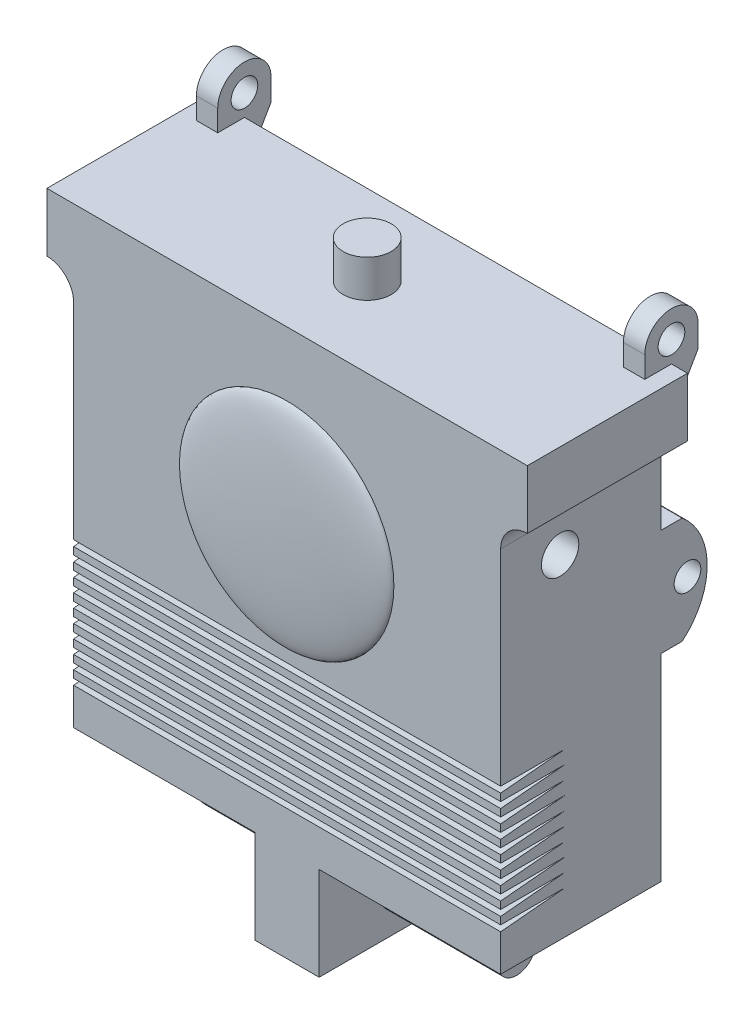
from build123d import *

# Parameters (mm, degrees)
SKETCH1_W                       = 90
SKETCH1_H                       = 30
BOSS_EXTRUDE1_DEPTH             = 85
SKETCH3_W                       = 30
SKETCH3_H                       = 17.5
BOSS_EXTRUDE2_DEPTH             = 6
SKETCH4_R                       = 3.5
BOSS_EXTRUDE3_DEPTH             = 22
CUT_EXTRUDE1_REACH              = 102.747
SKETCH6_R                       = 3.5
CUT_EXTRUDE2_DEPTH              = 9
BOSS_EXTRUDE4_DEPTH             = 2
BOSS_EXTRUDE5_REACH             = 130.3
BOSS_EXTRUDE5_DIRECTION_2_REACH = 130.3
SKETCH9_R                       = 2.5
CUT_EXTRUDE3_DEPTH              = 4
BOSS_EXTRUDE6_DEPTH             = 80
SKETCH11_R                      = 2.5
CUT_EXTRUDE4_DEPTH              = 80
SKETCH12_R                      = 4.5
BOSS_EXTRUDE7_DEPTH             = 7
CUT_EXTRUDE5_DEPTH              = 80
LPATTERN1_COUNT                 = 10
LPATTERN1_PITCH                 = 2.5
SKETCH14_W                      = 10
SKETCH14_H                      = 4.5
CUT_EXTRUDE6_DEPTH              = 2
LPATTERN2_COUNT                 = 5
LPATTERN2_PITCH                 = 7
LPATTERN2_COUNT_DIR2            = 6
LPATTERN2_PITCH_DIR2            = 13.25


# Read off the part's stored shape, not the designer's step: Dome1
with BuildPart() as part:
    # Sketch1 → Boss-Extrude1 (new body)
    with BuildSketch(Plane(origin=(0, 0, 0), x_dir=(1, 0, 0), z_dir=(0, 1, 0))):
        Rectangle(SKETCH1_W, SKETCH1_H)
    extrude(amount=BOSS_EXTRUDE1_DEPTH)

    # Dome1 outline → Dome1 (revolve)
    with BuildSketch(Plane.XZ.offset(-53)):
        with BuildLine():
            add(Edge.make_bspline(
                [(0, 17.5), (20, 17.5), (20, 15)],
                knots=[4.71238898, 4.71238898, 4.71238898, 6.283185307, 6.283185307, 6.283185307], degree=2, weights=[1, 0.707106781, 1]))
            Line((0, 17.5), (0, 14.9999999))
            Line((0, 14.9999999), (20, 15))
        make_face()
    revolve(axis=Axis((0, 53, 0), (0, 0, 1)))

    # Sketch3 → Boss-Extrude2 (add, symmetric)
    with BuildSketch(Plane(origin=(0, 0, 0), x_dir=(0, 0, -1), z_dir=(1, 0, 0))):
        with Locations((0, -8.75)):
            Rectangle(SKETCH3_W, SKETCH3_H)
    extrude(amount=BOSS_EXTRUDE2_DEPTH, both=True)

    # Sketch4 → Boss-Extrude3 (add)
    with BuildSketch(Plane.ZY.offset(6)):
        with Locations(Location((0, -10.2, 0), (0, 0, 180))):
            Circle(SKETCH4_R)
    boss_extrude3 = extrude(amount=BOSS_EXTRUDE3_DEPTH)

    # Mirror1: Boss-Extrude3 across plane
    add(boss_extrude3.mirror(Plane(origin=(0, 0, 0), x_dir=(0, 0, 1), z_dir=(1, 0, 0))))

    # Sketch5 → Cut-Extrude1 (cut, up to next)
    with BuildSketch(Plane.XY.offset(15), mode=Mode.PRIVATE) as cut_extrude1_sk1:
        with BuildLine():
            Line((40, 0), (40, 69))
            ThreePointArc((40, 69), (41.464466094, 72.535533906), (45, 74))
            Line((45, 74), (45, 0))
            Line((45, 0), (40, 0))
        make_face()
    cut_extrude1_tool1 = extrude(cut_extrude1_sk1.sketch, amount=-CUT_EXTRUDE1_REACH, mode=Mode.PRIVATE) & part.part
    cut_extrude1 = cut_extrude1_tool1.solids().sort_by_distance((42.520351, 36.472034, 15))[0]
    add(cut_extrude1, mode=Mode.SUBTRACT)

    # Mirror2: Cut-Extrude1 across plane
    add(cut_extrude1.mirror(Plane(origin=(0, 0, 0), x_dir=(0, 0, 1), z_dir=(1, 0, 0))), mode=Mode.SUBTRACT)

    # Sketch6 → Cut-Extrude2 (cut)
    with BuildSketch(Plane(origin=(40, 0, 0), x_dir=(0, 0, -1), z_dir=(1, 0, 0))):
        with Locations((-3.86, 62.5)):
            Circle(SKETCH6_R)
    cut_extrude2 = extrude(amount=-CUT_EXTRUDE2_DEPTH, mode=Mode.SUBTRACT)

    # Mirror3: Cut-Extrude2 across plane
    add(cut_extrude2.mirror(Plane(origin=(0, 0, 0), x_dir=(0, 0, 1), z_dir=(1, 0, 0))), mode=Mode.SUBTRACT)

    # Sketch7 → Boss-Extrude4 (add, symmetric)
    with BuildSketch(Plane.ZY.offset(40)):
        with BuildLine():
            Line((-10, 85), (-20, 85))
            Line((-20, 85), (-20, 89))
            ThreePointArc((-20, 89), (-15, 94), (-10, 89))
            Line((-10, 89), (-10, 85))
        make_face()
    boss_extrude4 = extrude(amount=BOSS_EXTRUDE4_DEPTH, both=True)

    # Boss-Extrude5: up to this face of the body (flat: up to its plane)
    boss_extrude5_end = Plane(part.part.faces().sort_by_distance((-42, 89.042050425, -15))[0])
    # Sketch8 → Boss-Extrude5 (add, up to the picked face)
    with BuildSketch(Plane.ZY.offset(40), mode=Mode.PRIVATE) as boss_extrude5_sk1:
        Polygon((-20, 85), (-15, 76.339745962), (-15, 85), align=None)
    boss_extrude5_tool1 = split(extrude(boss_extrude5_sk1.sketch, amount=BOSS_EXTRUDE5_REACH, mode=Mode.PRIVATE), bisect_by=boss_extrude5_end, keep=Keep.BOTH, mode=Mode.PRIVATE)
    boss_extrude5 = boss_extrude5_tool1.solids().sort_by(Axis((-40, 82.113249, -16.666667), (-1, 0, 0)))[0]
    add(boss_extrude5)

    # Boss-Extrude5 direction 2: up to this face of the body (flat: up to its plane)
    boss_extrude5_direction_2_end = Plane(part.part.faces().sort_by_distance((-38, 89.042050425, -15))[0])
    # Sketch8 → Boss-Extrude5 direction 2 (add, up to the picked face)
    with BuildSketch(Plane.ZY.offset(40), mode=Mode.PRIVATE) as boss_extrude5_direction_2_sk1:
        Polygon((-20, 85), (-15, 76.339745962), (-15, 85), align=None)
    boss_extrude5_direction_2_tool1 = split(extrude(boss_extrude5_direction_2_sk1.sketch, amount=-BOSS_EXTRUDE5_DIRECTION_2_REACH, mode=Mode.PRIVATE), bisect_by=boss_extrude5_direction_2_end, keep=Keep.BOTH, mode=Mode.PRIVATE)
    boss_extrude5_direction_2 = boss_extrude5_direction_2_tool1.solids().sort_by(Axis((-40, 82.113249, -16.666667), (1, 0, 0)))[0]
    add(boss_extrude5_direction_2)

    # Sketch9 → Cut-Extrude3 (cut)
    with BuildSketch(Plane.ZY.offset(42)):
        with Locations((-15, 89)):
            Circle(SKETCH9_R)
    cut_extrude3 = extrude(amount=-CUT_EXTRUDE3_DEPTH, mode=Mode.SUBTRACT)

    # Mirror4: Boss-Extrude4, Boss-Extrude5, Boss-Extrude5 direction 2, Cut-Extrude3 across plane
    add(boss_extrude4.mirror(Plane(origin=(0, 0, 0), x_dir=(0, 0, 1), z_dir=(1, 0, 0))))
    add(boss_extrude5.mirror(Plane(origin=(0, 0, 0), x_dir=(0, 0, 1), z_dir=(1, 0, 0))))
    add(boss_extrude5_direction_2.mirror(Plane(origin=(0, 0, 0), x_dir=(0, 0, 1), z_dir=(1, 0, 0))))
    add(cut_extrude3.mirror(Plane(origin=(0, 0, 0), x_dir=(0, 0, 1), z_dir=(1, 0, 0))), mode=Mode.SUBTRACT)

    # Sketch10 → Boss-Extrude6 (add)
    with BuildSketch(Plane.ZY.offset(40)):
        with BuildLine():
            Line((-19, 37), (-15, 37))
            Line((-15, 37), (-15, 57))
            Line((-15, 57), (-19, 57))
            ThreePointArc((-19, 57), (-23.693376137, 47), (-19, 37))
        make_face()
    extrude(amount=-BOSS_EXTRUDE6_DEPTH)

    # Sketch11 → Cut-Extrude4 (cut)
    with BuildSketch(Plane.ZY.offset(40)):
        with Locations((-20, 47)):
            Circle(SKETCH11_R)
    extrude(amount=-CUT_EXTRUDE4_DEPTH, mode=Mode.SUBTRACT)

    # Sketch12 → Boss-Extrude7 (add)
    with BuildSketch(Plane(origin=(0, 85, 0), x_dir=(1, 0, 0), z_dir=(0, 1, 0))):
        with Locations(Location((0, 0, 0), (0, 0, 270))):
            Circle(SKETCH12_R)
    extrude(amount=BOSS_EXTRUDE7_DEPTH)

    # Sketch13 → Cut-Extrude5 (cut)
    with BuildSketch(Plane.ZY.offset(40)):
        Polygon((15, 8), (3, 8), (15, 6.88), align=None)
    cut_extrude5 = extrude(amount=-CUT_EXTRUDE5_DEPTH, mode=Mode.SUBTRACT)

    # LPattern1: Cut-Extrude5 ×10
    with Locations(*[(0, i * LPATTERN1_PITCH, 0) for i in range(1, LPATTERN1_COUNT)]):
        add(cut_extrude5, mode=Mode.SUBTRACT)

    # Sketch14 → Cut-Extrude6 (cut)
    with BuildSketch(Plane(origin=(0, 0, -15), x_dir=(-1, 0, 0), z_dir=(0, 0, -1))):
        with Locations((-33, 4.25)):
            Rectangle(SKETCH14_W, SKETCH14_H)
    cut_extrude6 = extrude(amount=-CUT_EXTRUDE6_DEPTH, mode=Mode.SUBTRACT)

    # LPattern2: Cut-Extrude6 5 × 6, 4 skipped
    with Locations(*[(-j * LPATTERN2_PITCH_DIR2, i * LPATTERN2_PITCH, 0) for i in range(LPATTERN2_COUNT) for j in range(LPATTERN2_COUNT_DIR2) if (i, j) not in ((0, 0), (1, 2), (1, 3), (3, 2), (3, 3))]):
        add(cut_extrude6, mode=Mode.SUBTRACT)


solid = part.part
